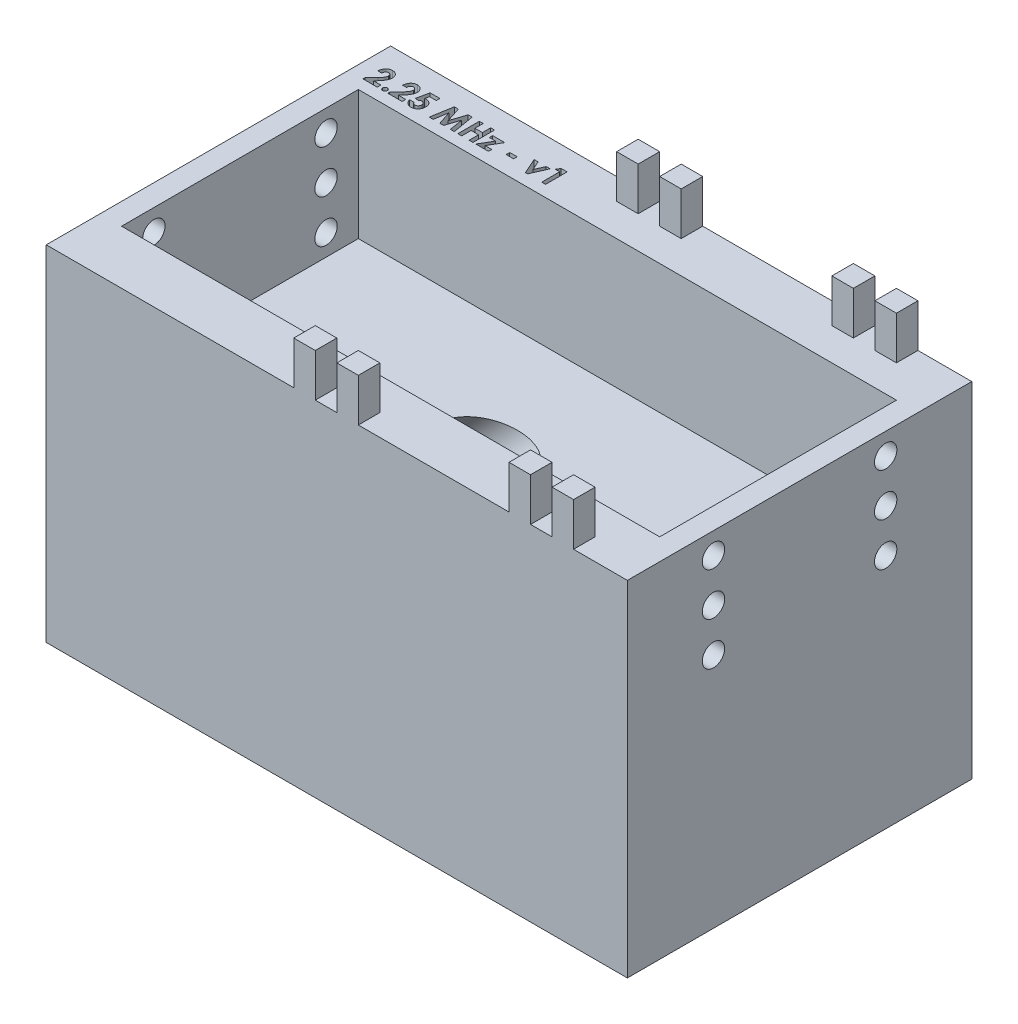
from build123d import *

# Parameters (mm, degrees)
SKETCH1_W                = 228.6
SKETCH1_H                = 127
BOSS_EXTRUDE1_DEPTH      = 50.8
SKETCH10_R               = 2.5
CUT_EXTRUDE6_DEPTH       = 196.514014843
SKETCH13_W               = 6.35
SKETCH13_H               = 6.35
BOSS_EXTRUDE3_DEPTH      = 12.7
SKETCH22_W               = 25.4
SKETCH22_H               = 101.6
CUT_EXTRUDE17_DEPTH      = 196.514014908
SKETCH23_W               = 254
SKETCH23_H               = 254
CUT_EXTRUDE18_DEPTH      = 25.4
SKETCH21_W               = 31.75
SKETCH21_H               = 101.6
CUT_EXTRUDE16_DEPTH      = 162.144934827
SKETCH26_W               = 158.75
SKETCH26_H               = 69.85
CUT_EXTRUDE21_DEPTH      = 38.1
CUT_EXTRUDE22_DEPTH      = 206.665511207
CUT_EXTRUDE22_DEPTH_BACK = 206.665511207
SKETCH27_R               = 3.302
SKETCH28_W               = 2.198076923
SKETCH28_H               = 1.058333333
CUT_EXTRUDE23_DEPTH      = 3.175


with BuildPart() as part:
    # Sketch1 → Boss-Extrude1 (new, symmetric)
    with BuildSketch(Plane.XY):
        with Locations((-25.4, -63.5)):
            Rectangle(SKETCH1_W, SKETCH1_H)
    extrude(amount=BOSS_EXTRUDE1_DEPTH, both=True)

    # Sketch10 → Cut-Extrude6 (cut, through all)
    with BuildSketch(Plane.XZ.offset(127)):
        Circle(SKETCH10_R)
    extrude(amount=-CUT_EXTRUDE6_DEPTH, mode=Mode.SUBTRACT)

    # Sketch2 → Cut-Revolve1 (revolve, cut)
    with BuildSketch(Plane.XY):
        Polygon((-66.480836064, -58.244528719), (-67.760522562, -56.964842222), (-13.33568034, -2.54), (0, 10.79568034), (55.525090121, 66.320770461), (59.72801651, 57.18801651), (0, -2.54), (-105.207008528, -107.747008528), (-129.286668415, -131.826668415), (-180.402882779, -182.942882779), (-185.791036451, -177.554729106), align=None)
    revolve(axis=Axis((-124.923032936, -127.463032936, 0), (0.7071067811865462, 0.7071067811865488, 0)), mode=Mode.SUBTRACT)

    # Sketch13 → Boss-Extrude3 (add)
    with BuildSketch(Plane(origin=(0, 0, 0), x_dir=(1, 0, 0), z_dir=(0, 1, 0))):
        with Locations((-38.1, 47.625)):
            Rectangle(SKETCH13_W, SKETCH13_H)
        with Locations((-25.4, 47.625)):
            Rectangle(SKETCH13_W, SKETCH13_H)
        with Locations((25.4, 47.625)):
            Rectangle(SKETCH13_W, SKETCH13_H)
        with Locations((38.1, 47.625)):
            Rectangle(SKETCH13_W, SKETCH13_H)
        with Locations((38.1, -47.625)):
            Rectangle(SKETCH13_W, SKETCH13_H)
        with Locations((25.4, -47.625)):
            Rectangle(SKETCH13_W, SKETCH13_H)
        with Locations((-25.4, -47.625)):
            Rectangle(SKETCH13_W, SKETCH13_H)
        with Locations((-38.1, -47.625)):
            Rectangle(SKETCH13_W, SKETCH13_H)
    extrude(amount=BOSS_EXTRUDE3_DEPTH)

    # Sketch22 → Cut-Extrude17 (cut, through all)
    with BuildSketch(Plane(origin=(0, 0, 0), x_dir=(1, 0, 0), z_dir=(0, 1, 0))):
        with Locations((-127, 0)):
            Rectangle(SKETCH22_W, SKETCH22_H)
    extrude(amount=-CUT_EXTRUDE17_DEPTH, mode=Mode.SUBTRACT)

    # Sketch23 → Cut-Extrude18 (cut)
    with BuildSketch(Plane.XZ.offset(127)):
        Rectangle(SKETCH23_W, SKETCH23_H)
    extrude(amount=-CUT_EXTRUDE18_DEPTH, mode=Mode.SUBTRACT)

    # Sketch21 → Cut-Extrude16 (cut, through all)
    with BuildSketch(Plane(origin=(0, 0, 0), x_dir=(1, 0, 0), z_dir=(0, 1, 0))):
        with Locations((73.025, 0)):
            Rectangle(SKETCH21_W, SKETCH21_H)
    extrude(amount=-CUT_EXTRUDE16_DEPTH, mode=Mode.SUBTRACT)

    # Sketch26 → Cut-Extrude21 (cut)
    with BuildSketch(Plane(origin=(0, 0, 0), x_dir=(1, 0, 0), z_dir=(0, 1, 0))):
        with Locations((-28.575, 0)):
            Rectangle(SKETCH26_W, SKETCH26_H)
    extrude(amount=-CUT_EXTRUDE21_DEPTH, mode=Mode.SUBTRACT)

    # Sketch27 → Cut-Extrude22 (cut, two sides: drawn at the far end of the back side and taken through both)
    with BuildSketch(Plane.ZY.offset(114.3).offset(-CUT_EXTRUDE22_DEPTH_BACK)):
        with Locations((-25.4, -6.35)):
            Circle(SKETCH27_R)
        with Locations((25.4, -6.35)):
            Circle(SKETCH27_R)
        with Locations((25.4, -19.05)):
            Circle(SKETCH27_R)
        with Locations((25.4, -31.75)):
            Circle(SKETCH27_R)
        with Locations((-25.4, -19.05)):
            Circle(SKETCH27_R)
        with Locations((-25.4, -31.75)):
            Circle(SKETCH27_R)
    extrude(amount=CUT_EXTRUDE22_DEPTH + CUT_EXTRUDE22_DEPTH_BACK, mode=Mode.SUBTRACT)

    # Sketch28 → Cut-Extrude23 (cut)
    with BuildSketch(Plane(origin=(0, 0, 0), x_dir=(1, 0, 0), z_dir=(0, 1, 0))):
        with BuildLine():
            Line((-108.679968791, 42.550408569), (-109.819712381, 42.550408569))
            add(Edge.make_bspline(
                [(-109.819712381, 42.550408569), (-109.814790003, 42.636624142), (-109.805171973, 42.805084195), (-109.766913878, 43.049777816), (-109.715649344, 43.28098638), (-109.647230018, 43.497901095), (-109.561256657, 43.70044314), (-109.459941579, 43.889302993), (-109.340696413, 44.063486302), (-109.206059088, 44.222153058), (-109.058315376, 44.364494468), (-108.900532582, 44.490703305), (-108.730297204, 44.59484766), (-108.550719582, 44.680548823), (-108.361830296, 44.74902007), (-108.161842154, 44.794798639), (-107.952486764, 44.825800335), (-107.809166047, 44.828513108), (-107.736118631, 44.829895748)],
                knots=[0, 0, 0, 0, 1.199038563, 2.342849363, 3.436047546, 4.486744587, 5.497670872, 6.488682221, 7.459191391, 8.424610317, 9.374430501, 10.305433194, 11.225809216, 12.140057399, 13.06607119, 14.010487599, 14.985989317, 16, 16, 16, 16], degree=3))
            add(Edge.make_bspline(
                [(-107.736118631, 44.829895748), (-107.646453965, 44.827097975), (-107.471407524, 44.821636064), (-107.217051161, 44.775044156), (-106.979510128, 44.697111989), (-106.758957095, 44.588220199), (-106.55726967, 44.449884594), (-106.374481297, 44.284942026), (-106.216119789, 44.089931913), (-106.081181086, 43.872968307), (-105.969063152, 43.643234383), (-105.890495573, 43.405679979), (-105.83885395, 43.166608826), (-105.833346051, 43.005630412), (-105.830609817, 42.92565897)],
                knots=[0, 0, 0, 0, 1.075374347, 2.099382735, 3.09057751, 4.06680945, 5.040638231, 6.016817125, 7.011024321, 8.044445721, 9.0776792, 10.070479129, 11.0414456, 12, 12, 12, 12], degree=3))
            add(Edge.make_bspline(
                [(-105.830609817, 42.92565897), (-105.831675162, 42.877286589), (-105.833819438, 42.779924936), (-105.848728877, 42.632592859), (-105.871095981, 42.482517913), (-105.904820123, 42.329828774), (-105.946876892, 42.17448264), (-105.997897832, 42.016014614), (-106.059066425, 41.855323151), (-106.129361889, 41.690599697), (-106.213224555, 41.521309458), (-106.310870974, 41.344914709), (-106.424892902, 41.161571926), (-106.553913097, 40.970245895), (-106.698558181, 40.771238367), (-106.859534262, 40.565148815), (-107.034987274, 40.351251044), (-107.159511212, 40.208272389), (-107.223488423, 40.134813617)],
                knots=[0, 0, 0, 0, 0.728284026, 1.46585585, 2.227944881, 3.01186502, 3.81876927, 4.650621989, 5.517437689, 6.406905708, 7.346299482, 8.360816762, 9.441613733, 10.596154504, 11.834900912, 13.145207542, 14.533280747, 16, 16, 16, 16], degree=3))
            Line((-107.223488423, 40.134813617), (-107.886218791, 39.375408569))
            Line((-107.886218791, 39.375408569), (-105.749199561, 39.375408569))
            Line((-105.749199561, 39.375408569), (-105.749199561, 38.317075236))
            Line((-105.749199561, 38.317075236), (-109.982532894, 38.317075236))
            Line((-109.982532894, 38.317075236), (-109.982532894, 38.894579242))
            Line((-109.982532894, 38.894579242), (-108.102464785, 40.8954907))
            add(Edge.make_bspline(
                [(-108.102464785, 40.8954907), (-108.048031982, 40.953857909), (-107.942611785, 41.066897883), (-107.792609708, 41.232909111), (-107.656871079, 41.390449803), (-107.538210549, 41.541197451), (-107.430400965, 41.680262414), (-107.338249549, 41.811836283), (-107.260913187, 41.934729584), (-107.176953598, 42.082917442), (-107.097219587, 42.259657832), (-107.024058806, 42.463270009), (-106.979462248, 42.657876356), (-106.973306513, 42.784686036), (-106.970353407, 42.845520748)],
                knots=[0, 0, 0, 0, 1.246127091, 2.413378631, 3.493388633, 4.492180848, 5.408488754, 6.240484944, 6.999099869, 7.674939598, 8.898438119, 10.020720584, 11.050475521, 12, 12, 12, 12], degree=3))
            add(Edge.make_bspline(
                [(-106.970353407, 42.845520748), (-106.972561373, 42.90437364), (-106.97683966, 43.018410552), (-107.023854577, 43.180627453), (-107.096691715, 43.327498297), (-107.19932953, 43.454634419), (-107.32365607, 43.5591106), (-107.467327066, 43.636817048), (-107.629171176, 43.681653313), (-107.74262698, 43.687265211), (-107.800992429, 43.690152159)],
                knots=[0, 0, 0, 0, 1.062038974, 2.057870785, 3.028805853, 4.01125022, 4.991535629, 5.949134679, 6.94496649, 8, 8, 8, 8], degree=3))
            add(Edge.make_bspline(
                [(-107.800992429, 43.690152159), (-107.831144764, 43.689085686), (-107.890504476, 43.686986162), (-107.977758614, 43.673010202), (-108.060787195, 43.648379032), (-108.140514374, 43.61537673), (-108.21608928, 43.571631942), (-108.28732129, 43.517709521), (-108.354960924, 43.454979759), (-108.418697958, 43.383638803), (-108.47670698, 43.304022276), (-108.528230382, 43.216857311), (-108.570831657, 43.122198014), (-108.608339368, 43.021294032), (-108.63726711, 42.913061575), (-108.658330094, 42.798148402), (-108.674342875, 42.676741461), (-108.678059371, 42.593285606), (-108.679968791, 42.550408569)],
                knots=[0, 0, 0, 0, 0.903469896, 1.778625579, 2.63899355, 3.493148037, 4.358286772, 5.247621495, 6.164656832, 7.118446693, 8.109501108, 9.111810964, 10.146451449, 11.215617525, 12.33435995, 13.498009769, 14.714554818, 16, 16, 16, 16], degree=3))
        make_face()
        with BuildLine():
            add(Edge.make_bspline(
                [(-104.080289304, 39.619639338), (-104.034279207, 39.617116715), (-103.943693271, 39.612150106), (-103.812808946, 39.575084821), (-103.694685089, 39.508491756), (-103.589066577, 39.421632645), (-103.499758223, 39.317129537), (-103.435208165, 39.19795652), (-103.395011225, 39.06757651), (-103.390573454, 38.97670558), (-103.388302125, 38.930196229)],
                knots=[0, 0, 0, 0, 1.016957001, 2.002212695, 2.9757545, 3.99499976, 5.013036768, 5.994806404, 6.97370641, 8, 8, 8, 8], degree=3))
            add(Edge.make_bspline(
                [(-103.388302125, 38.930196229), (-103.390558575, 38.883679409), (-103.394967274, 38.792793885), (-103.435486324, 38.66215982), (-103.499661765, 38.542007309), (-103.589073743, 38.436384382), (-103.694247686, 38.347888329), (-103.813080534, 38.28190935), (-103.943443939, 38.242741446), (-104.034235322, 38.238046495), (-104.080289304, 38.235664979)],
                knots=[0, 0, 0, 0, 1.023218912, 1.999186227, 2.986238111, 4.008388923, 5.030539734, 6.0011649, 6.986089706, 8, 8, 8, 8], degree=3))
            add(Edge.make_bspline(
                [(-104.080289304, 38.235664979), (-104.126354199, 38.23802713), (-104.217167094, 38.242683902), (-104.347733141, 38.282239497), (-104.467443305, 38.347447828), (-104.572643674, 38.436491727), (-104.662455104, 38.541633289), (-104.724805978, 38.662538922), (-104.765702452, 38.792744634), (-104.770050881, 38.883662735), (-104.772276484, 38.930196229)],
                knots=[0, 0, 0, 0, 1.013427518, 1.99788335, 2.976245624, 3.997909735, 5.019573847, 6.001765691, 6.977268297, 8, 8, 8, 8], degree=3))
            add(Edge.make_bspline(
                [(-104.772276484, 38.930196229), (-104.770036198, 38.976722544), (-104.765659081, 39.067626618), (-104.725083345, 39.197573051), (-104.662355176, 39.317505589), (-104.572651164, 39.421525076), (-104.467003649, 39.508928819), (-104.348006252, 39.574759198), (-104.216917888, 39.612208075), (-104.126310366, 39.617136241), (-104.080289304, 39.619639338)],
                knots=[0, 0, 0, 0, 1.025808215, 2.00424526, 2.981110158, 3.998665696, 5.017428914, 5.998734231, 6.983523959, 8, 8, 8, 8], degree=3))
        make_face()
        with BuildLine():
            Line((-101.353045714, 42.550408569), (-102.492789304, 42.550408569))
            add(Edge.make_bspline(
                [(-102.492789304, 42.550408569), (-102.487866926, 42.636624142), (-102.478248896, 42.805084195), (-102.439990801, 43.049777816), (-102.388726267, 43.28098638), (-102.320306941, 43.497901095), (-102.23433358, 43.70044314), (-102.133018502, 43.889302993), (-102.013773336, 44.063486302), (-101.879136012, 44.222153058), (-101.7313923, 44.364494468), (-101.573609505, 44.490703305), (-101.403374127, 44.59484766), (-101.223796505, 44.680548823), (-101.034907219, 44.74902007), (-100.834919077, 44.794798639), (-100.625563687, 44.825800335), (-100.48224297, 44.828513108), (-100.409195554, 44.829895748)],
                knots=[0, 0, 0, 0, 1.199038563, 2.342849363, 3.436047546, 4.486744587, 5.497670872, 6.488682221, 7.459191391, 8.424610317, 9.374430501, 10.305433194, 11.225809216, 12.140057399, 13.06607119, 14.010487599, 14.985989317, 16, 16, 16, 16], degree=3))
            add(Edge.make_bspline(
                [(-100.409195554, 44.829895748), (-100.319530888, 44.827097975), (-100.144484447, 44.821636064), (-99.890128084, 44.775044156), (-99.652587051, 44.697111989), (-99.432034018, 44.588220199), (-99.230346593, 44.449884594), (-99.04755822, 44.284942026), (-98.889196712, 44.089931913), (-98.754258009, 43.872968307), (-98.642140075, 43.643234383), (-98.563572496, 43.405679979), (-98.511930873, 43.166608826), (-98.506422974, 43.005630412), (-98.50368674, 42.92565897)],
                knots=[0, 0, 0, 0, 1.075374347, 2.099382735, 3.09057751, 4.06680945, 5.040638231, 6.016817125, 7.011024321, 8.044445721, 9.0776792, 10.070479129, 11.0414456, 12, 12, 12, 12], degree=3))
            add(Edge.make_bspline(
                [(-98.50368674, 42.92565897), (-98.504752085, 42.877286589), (-98.506896361, 42.779924936), (-98.5218058, 42.632592859), (-98.544172904, 42.482517913), (-98.577897046, 42.329828774), (-98.619953815, 42.17448264), (-98.670974756, 42.016014614), (-98.732143348, 41.855323151), (-98.802438812, 41.690599697), (-98.886301479, 41.521309458), (-98.983947897, 41.344914709), (-99.097969825, 41.161571926), (-99.22699002, 40.970245895), (-99.371635104, 40.771238367), (-99.532611185, 40.565148815), (-99.708064197, 40.351251044), (-99.832588135, 40.208272389), (-99.896565346, 40.134813617)],
                knots=[0, 0, 0, 0, 0.728284026, 1.46585585, 2.227944881, 3.01186502, 3.81876927, 4.650621989, 5.517437689, 6.406905708, 7.346299482, 8.360816762, 9.441613733, 10.596154504, 11.834900912, 13.145207542, 14.533280747, 16, 16, 16, 16], degree=3))
            Line((-99.896565346, 40.134813617), (-100.559295714, 39.375408569))
            Line((-100.559295714, 39.375408569), (-98.422276484, 39.375408569))
            Line((-98.422276484, 39.375408569), (-98.422276484, 38.317075236))
            Line((-98.422276484, 38.317075236), (-102.655609817, 38.317075236))
            Line((-102.655609817, 38.317075236), (-102.655609817, 38.894579242))
            Line((-102.655609817, 38.894579242), (-100.775541708, 40.8954907))
            add(Edge.make_bspline(
                [(-100.775541708, 40.8954907), (-100.721108905, 40.953857909), (-100.615688708, 41.066897883), (-100.465686631, 41.232909111), (-100.329948002, 41.390449803), (-100.211287472, 41.541197451), (-100.103477888, 41.680262414), (-100.011326472, 41.811836283), (-99.93399011, 41.934729584), (-99.850030521, 42.082917442), (-99.77029651, 42.259657832), (-99.69713573, 42.463270009), (-99.652539171, 42.657876356), (-99.646383436, 42.784686036), (-99.64343033, 42.845520748)],
                knots=[0, 0, 0, 0, 1.246127091, 2.413378631, 3.493388633, 4.492180848, 5.408488754, 6.240484944, 6.999099869, 7.674939598, 8.898438119, 10.020720584, 11.050475521, 12, 12, 12, 12], degree=3))
            add(Edge.make_bspline(
                [(-99.64343033, 42.845520748), (-99.645638296, 42.90437364), (-99.649916583, 43.018410552), (-99.6969315, 43.180627453), (-99.769768638, 43.327498297), (-99.872406453, 43.454634419), (-99.996732993, 43.5591106), (-100.140403989, 43.636817048), (-100.302248099, 43.681653313), (-100.415703903, 43.687265211), (-100.474069352, 43.690152159)],
                knots=[0, 0, 0, 0, 1.062038974, 2.057870785, 3.028805853, 4.01125022, 4.991535629, 5.949134679, 6.94496649, 8, 8, 8, 8], degree=3))
            add(Edge.make_bspline(
                [(-100.474069352, 43.690152159), (-100.504221687, 43.689085686), (-100.563581399, 43.686986162), (-100.650835537, 43.673010202), (-100.733864118, 43.648379032), (-100.813591297, 43.61537673), (-100.889166203, 43.571631942), (-100.960398213, 43.517709521), (-101.028037847, 43.454979759), (-101.091774881, 43.383638803), (-101.149783903, 43.304022276), (-101.201307305, 43.216857311), (-101.24390858, 43.122198014), (-101.281416291, 43.021294032), (-101.310344033, 42.913061575), (-101.331407018, 42.798148402), (-101.347419798, 42.676741461), (-101.351136294, 42.593285606), (-101.353045714, 42.550408569)],
                knots=[0, 0, 0, 0, 0.903469896, 1.778625579, 2.63899355, 3.493148037, 4.358286772, 5.247621495, 6.164656832, 7.118446693, 8.109501108, 9.111810964, 10.146451449, 11.215617525, 12.33435995, 13.498009769, 14.714554818, 16, 16, 16, 16], degree=3))
        make_face()
        with BuildLine():
            Line((-96.510407493, 44.667075236), (-93.619071355, 44.667075236))
            Line((-93.619071355, 44.667075236), (-93.619071355, 43.608741902))
            Line((-93.619071355, 43.608741902), (-95.607262461, 43.608741902))
            Line((-95.607262461, 43.608741902), (-95.855309336, 42.40794062))
            add(Edge.make_bspline(
                [(-95.855309336, 42.40794062), (-95.821509399, 42.41735433), (-95.754848978, 42.435920098), (-95.65442497, 42.454539215), (-95.557100113, 42.466607535), (-95.493236135, 42.468217288), (-95.462250442, 42.468998313)],
                knots=[0, 0, 0, 0, 1.05461699, 2.079921384, 3.068411212, 4, 4, 4, 4], degree=3))
            add(Edge.make_bspline(
                [(-95.462250442, 42.468998313), (-95.394729372, 42.467451106), (-95.261630468, 42.464401222), (-95.066923663, 42.435447873), (-94.880480394, 42.389847225), (-94.702871199, 42.324811292), (-94.534269578, 42.240165346), (-94.374471154, 42.13776748), (-94.2232798, 42.017437844), (-94.083381311, 41.879101104), (-93.954836736, 41.727204232), (-93.843074559, 41.562911691), (-93.747622686, 41.388566135), (-93.671703566, 41.203083835), (-93.611781724, 41.007629744), (-93.568480863, 40.802078611), (-93.542874901, 40.586186825), (-93.539422094, 40.438899295), (-93.537661099, 40.363779963)],
                knots=[0, 0, 0, 0, 1.01440847, 1.999622559, 2.951875003, 3.895578053, 4.836219714, 5.782137149, 6.743708247, 7.735272588, 8.734977101, 9.730283169, 10.717124674, 11.717316708, 12.737475749, 13.78628267, 14.87096371, 16, 16, 16, 16], degree=3))
            add(Edge.make_bspline(
                [(-93.537661099, 40.363779963), (-93.539813063, 40.287807853), (-93.544059516, 40.137892672), (-93.571763735, 39.917464328), (-93.620662179, 39.706343737), (-93.687829084, 39.503965733), (-93.776317182, 39.311817747), (-93.88273623, 39.12790927), (-94.008885488, 38.953605395), (-94.153526998, 38.790692948), (-94.310771294, 38.641787844), (-94.47819935, 38.510795739), (-94.654634935, 38.400566944), (-94.840082304, 38.311483441), (-95.033477488, 38.24100216), (-95.234879184, 38.189695152), (-95.445266178, 38.160273434), (-95.588091612, 38.156283006), (-95.660687942, 38.154254723)],
                knots=[0, 0, 0, 0, 1.06808661, 2.107647099, 3.116961351, 4.110378221, 5.100014249, 6.085620622, 7.093190682, 8.119403071, 9.144090782, 10.133780668, 11.103064255, 12.062861538, 13.020824475, 13.992378307, 14.979551724, 16, 16, 16, 16], degree=3))
            add(Edge.make_bspline(
                [(-95.660687942, 38.154254723), (-95.725608679, 38.155913985), (-95.853645959, 38.159186396), (-96.042239252, 38.179300361), (-96.224064128, 38.21486204), (-96.398155298, 38.266328997), (-96.566344491, 38.329673072), (-96.726687391, 38.408896809), (-96.880065112, 38.50249168), (-97.026042117, 38.608749578), (-97.162246489, 38.728444979), (-97.286559406, 38.859472218), (-97.399733477, 39.000179761), (-97.499346952, 39.152303511), (-97.585087573, 39.315618714), (-97.661124106, 39.488200664), (-97.723360769, 39.671851665), (-97.754944083, 39.799168742), (-97.770994432, 39.863870107)],
                knots=[0, 0, 0, 0, 1.054957082, 2.080596141, 3.077793124, 4.061112343, 5.027190972, 5.994718051, 6.962465889, 7.943658696, 8.924948258, 9.904494768, 10.875059, 11.855380583, 12.854004648, 13.869083016, 14.917087635, 16, 16, 16, 16], degree=3))
            Line((-97.770994432, 39.863870107), (-96.46843033, 39.863870107))
            add(Edge.make_bspline(
                [(-96.46843033, 39.863870107), (-96.444619427, 39.819034696), (-96.398345653, 39.731902191), (-96.310322707, 39.616220699), (-96.211786606, 39.517572491), (-96.103626201, 39.434993755), (-95.985140679, 39.373127172), (-95.861158102, 39.326210417), (-95.730120928, 39.299098962), (-95.640878827, 39.295709761), (-95.595814144, 39.293998313)],
                knots=[0, 0, 0, 0, 1.104910296, 2.147267069, 3.153527244, 4.136738762, 5.099945312, 6.05603338, 7.018353, 8, 8, 8, 8], degree=3))
            add(Edge.make_bspline(
                [(-95.595814144, 39.293998313), (-95.564404664, 39.295180083), (-95.502605983, 39.297505235), (-95.411555399, 39.309805876), (-95.324643617, 39.33310301), (-95.241224467, 39.365364125), (-95.161073865, 39.405597379), (-95.085340799, 39.456389242), (-95.012707647, 39.514852558), (-94.944280183, 39.581939412), (-94.882304624, 39.656725649), (-94.827958838, 39.737088559), (-94.77936621, 39.821242461), (-94.743372908, 39.912520901), (-94.713897437, 40.008198274), (-94.692190508, 40.108996304), (-94.67921817, 40.215032713), (-94.678017279, 40.287420797), (-94.677404689, 40.32434687)],
                knots=[0, 0, 0, 0, 0.978869489, 1.925942215, 2.855067702, 3.774946051, 4.70828698, 5.642468714, 6.60995405, 7.609372294, 8.622401667, 9.629904756, 10.629323, 11.642352373, 12.678539694, 13.745912462, 14.850161547, 16, 16, 16, 16], degree=3))
            add(Edge.make_bspline(
                [(-94.677404689, 40.32434687), (-94.67811567, 40.360415806), (-94.679499613, 40.430624865), (-94.690947862, 40.533716912), (-94.71142856, 40.631532608), (-94.739333687, 40.724821147), (-94.77505558, 40.813016037), (-94.818710122, 40.896642256), (-94.870483809, 40.975277103), (-94.930654602, 41.047319652), (-94.994820117, 41.113399126), (-95.063754498, 41.171191707), (-95.136836684, 41.219155537), (-95.211795735, 41.261029356), (-95.291623746, 41.291504209), (-95.374525707, 41.312491116), (-95.460414435, 41.327890464), (-95.518997273, 41.328795232), (-95.548748839, 41.329254723)],
                knots=[0, 0, 0, 0, 1.166249705, 2.270133367, 3.348514167, 4.393962215, 5.415026464, 6.420877785, 7.440098956, 8.453121383, 9.451844239, 10.415694839, 11.355045125, 12.27538808, 13.187007209, 14.108269027, 15.039275622, 16, 16, 16, 16], degree=3))
            add(Edge.make_bspline(
                [(-95.548748839, 41.329254723), (-95.581065956, 41.328028468), (-95.645836389, 41.32557079), (-95.742069043, 41.305573319), (-95.837141398, 41.27320991), (-95.931582155, 41.228559459), (-96.024453826, 41.170126106), (-96.118207339, 41.101590484), (-96.209704564, 41.017972827), (-96.267881044, 40.955694206), (-96.297977605, 40.923475476)],
                knots=[0, 0, 0, 0, 0.88288272, 1.769486374, 2.674910571, 3.623812639, 4.617874466, 5.670434592, 6.794841017, 8, 8, 8, 8], degree=3))
            Line((-96.297977605, 40.923475476), (-97.257092189, 41.143537575))
            Line((-97.257092189, 41.143537575), (-96.510407493, 44.667075236))
        make_face()
        Polygon((-89.371745634, 44.667075236), (-88.188752846, 44.667075236), (-86.739904689, 40.237848473), (-85.28088025, 44.667075236), (-84.109335779, 44.667075236), (-83.035738022, 38.317075236), (-84.189474, 38.317075236), (-84.867468791, 42.327802399), (-86.187841388, 38.317075236), (-87.299600202, 38.317075236), (-88.612340586, 42.327802399), (-89.289063343, 38.317075236), (-90.444071355, 38.317075236), align=None)
        Polygon((-81.977404689, 44.667075236), (-80.837661099, 44.667075236), (-80.837661099, 42.224767543), (-78.639584176, 42.224767543), (-78.639584176, 44.667075236), (-77.499840586, 44.667075236), (-77.499840586, 38.317075236), (-78.639584176, 38.317075236), (-78.639584176, 41.085023954), (-80.837661099, 41.085023954), (-80.837661099, 38.317075236), (-81.977404689, 38.317075236), align=None)
        Polygon((-76.360096996, 42.957459851), (-72.778045714, 42.957459851), (-74.912520875, 39.293998313), (-72.940866227, 39.293998313), (-72.940866227, 38.317075236), (-76.685738022, 38.317075236), (-74.551262862, 41.980536774), (-76.360096996, 41.980536774), align=None)
        with Locations((-68.422596997, 40.637267544)):
            Rectangle(SKETCH28_W, SKETCH28_H)
        Polygon((-64.107853407, 42.957459851), (-62.947757253, 42.957459851), (-61.746955971, 40.218767944), (-60.546154689, 42.957459851), (-59.386058535, 42.957459851), (-61.418770875, 38.317075236), (-62.075141067, 38.317075236), align=None)
        Polygon((-57.85071198, 44.667075236), (-56.08894315, 44.667075236), (-56.08894315, 38.317075236), (-57.22868674, 38.317075236), (-57.22868674, 43.608741902), (-58.531250843, 43.608741902), align=None)
    extrude(amount=-CUT_EXTRUDE23_DEPTH, mode=Mode.SUBTRACT)


solid = part.part
